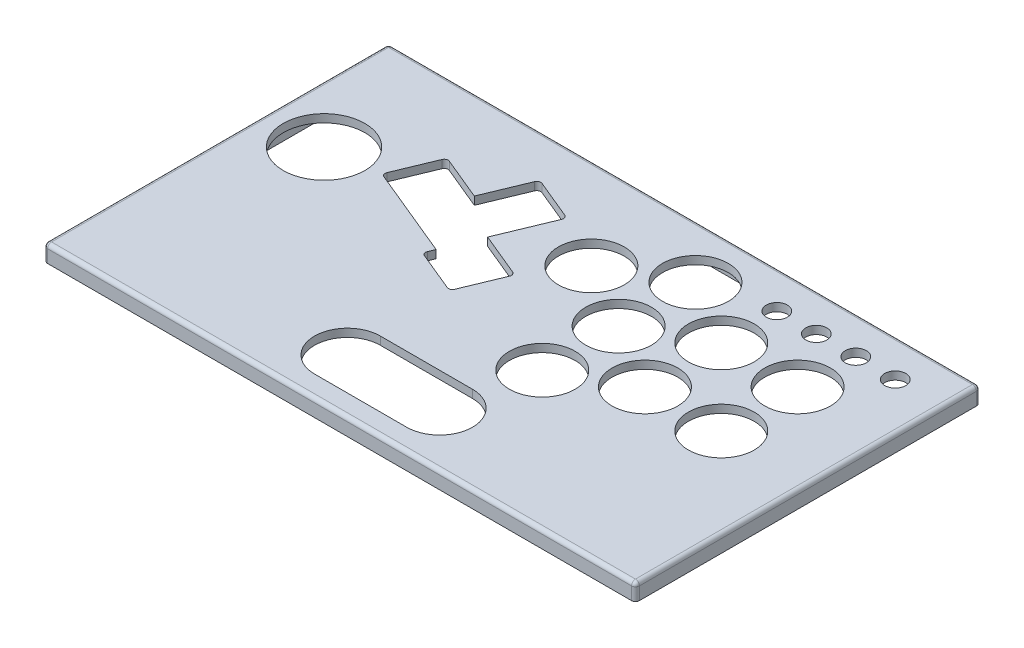
from build123d import *

# Parameters (mm, degrees)
SKETCH2_W                       = 224.807886448
SKETCH2_H                       = 130.999439424
TOP_PLATE_DEPTH                 = 6.35
PRIMARY_BUTTON_CUTOUTS_REACH    = 159.75
BUTTON_CUTOUTS_R                = 12.5
BUTTON_CUTOUTS_R_2              = 15.5
FILLET1_R                       = 1.5
EXTRA_BUTTONS_REACH             = 159.75
SKETCH3_R                       = 4
SKETCH4_W                       = 212.807886448
SKETCH4_H                       = 118.999439424
CUT_EXTRUDE2_DEPTH              = 3.3
FILLET2_R                       = 1.5
SKETCH5_W                       = 35
SKETCH5_H                       = 6
CUT_EXTRUDE3_DEPTH              = 3
TAP_DRILL_FOR_M3X0_5_TAP1_D     = 2.5
TAP_DRILL_FOR_M3X0_5_TAP1_DEPTH = 4
TAP_DRILL_FOR_M3X0_5_TAP1_TIP   = 0.751075774


with BuildPart() as part:
    # Sketch2 → top plate (new body)
    with BuildSketch(Plane(origin=(0, 0, 0), x_dir=(1, 0, 0), z_dir=(0, 1, 0))):
        with Locations((0, 44.999719712)):
            Rectangle(SKETCH2_W, SKETCH2_H)
    extrude(amount=TOP_PLATE_DEPTH)

    # Button Cutouts → primary button cutouts (cut, up to next)
    with BuildSketch(Plane(origin=(0, 0, 0), x_dir=(1, 0, 0), z_dir=(0, 1, 0)), mode=Mode.PRIVATE) as primary_button_cutouts_sk1:
        with Locations((24.5, 32)):
            Circle(BUTTON_CUTOUTS_R)
    primary_button_cutouts_tool1 = extrude(primary_button_cutouts_sk1.sketch, amount=PRIMARY_BUTTON_CUTOUTS_REACH, mode=Mode.PRIVATE) & part.part
    # Button Cutouts → primary button cutouts (cut, up to next)
    with BuildSketch(Plane(origin=(0, 0, 0), x_dir=(1, 0, 0), z_dir=(0, 1, 0)), mode=Mode.PRIVATE) as primary_button_cutouts_sk2:
        with Locations((24.5, 61)):
            Circle(BUTTON_CUTOUTS_R)
    primary_button_cutouts_tool2 = extrude(primary_button_cutouts_sk2.sketch, amount=PRIMARY_BUTTON_CUTOUTS_REACH, mode=Mode.PRIVATE) & part.part
    # Button Cutouts → primary button cutouts (cut, up to next)
    with BuildSketch(Plane(origin=(0, 0, 0), x_dir=(1, 0, 0), z_dir=(0, 1, 0)), mode=Mode.PRIVATE) as primary_button_cutouts_sk3:
        with Locations((49.5, 46)):
            Circle(BUTTON_CUTOUTS_R)
    primary_button_cutouts_tool3 = extrude(primary_button_cutouts_sk3.sketch, amount=PRIMARY_BUTTON_CUTOUTS_REACH, mode=Mode.PRIVATE) & part.part
    # Button Cutouts → primary button cutouts (cut, up to next)
    with BuildSketch(Plane(origin=(0, 0, 0), x_dir=(1, 0, 0), z_dir=(0, 1, 0)), mode=Mode.PRIVATE) as primary_button_cutouts_sk4:
        with Locations((49.5, 75)):
            Circle(BUTTON_CUTOUTS_R)
    primary_button_cutouts_tool4 = extrude(primary_button_cutouts_sk4.sketch, amount=PRIMARY_BUTTON_CUTOUTS_REACH, mode=Mode.PRIVATE) & part.part
    # Button Cutouts → primary button cutouts (cut, up to next)
    with BuildSketch(Plane(origin=(0, 0, 0), x_dir=(1, 0, 0), z_dir=(0, 1, 0)), mode=Mode.PRIVATE) as primary_button_cutouts_sk5:
        with Locations((78.5, 75)):
            Circle(BUTTON_CUTOUTS_R)
    primary_button_cutouts_tool5 = extrude(primary_button_cutouts_sk5.sketch, amount=PRIMARY_BUTTON_CUTOUTS_REACH, mode=Mode.PRIVATE) & part.part
    # Button Cutouts → primary button cutouts (cut, up to next)
    with BuildSketch(Plane(origin=(0, 0, 0), x_dir=(1, 0, 0), z_dir=(0, 1, 0)), mode=Mode.PRIVATE) as primary_button_cutouts_sk6:
        with Locations((78.5, 46)):
            Circle(BUTTON_CUTOUTS_R)
    primary_button_cutouts_tool6 = extrude(primary_button_cutouts_sk6.sketch, amount=PRIMARY_BUTTON_CUTOUTS_REACH, mode=Mode.PRIVATE) & part.part
    # Button Cutouts → primary button cutouts (cut, up to next)
    with BuildSketch(Plane(origin=(0, 0, 0), x_dir=(1, 0, 0), z_dir=(0, 1, 0)), mode=Mode.PRIVATE) as primary_button_cutouts_sk7:
        with Locations((-90.403943224, 64.008304483)):
            Circle(BUTTON_CUTOUTS_R_2)
    primary_button_cutouts_tool7 = extrude(primary_button_cutouts_sk7.sketch, amount=PRIMARY_BUTTON_CUTOUTS_REACH, mode=Mode.PRIVATE) & part.part
    # Button Cutouts → primary button cutouts (cut, up to next)
    with BuildSketch(Plane(origin=(0, 0, 0), x_dir=(1, 0, 0), z_dir=(0, 1, 0)), mode=Mode.PRIVATE) as primary_button_cutouts_sk8:
        with Locations((24.680313923, 89.999439424)):
            Circle(BUTTON_CUTOUTS_R)
    primary_button_cutouts_tool8 = extrude(primary_button_cutouts_sk8.sketch, amount=PRIMARY_BUTTON_CUTOUTS_REACH, mode=Mode.PRIVATE) & part.part
    # Button Cutouts → primary button cutouts (cut, up to next)
    with BuildSketch(Plane(origin=(0, 0, 0), x_dir=(1, 0, 0), z_dir=(0, 1, 0)), mode=Mode.PRIVATE) as primary_button_cutouts_sk9:
        with Locations((-0.524094275, 75.65587615)):
            Circle(BUTTON_CUTOUTS_R)
    primary_button_cutouts_tool9 = extrude(primary_button_cutouts_sk9.sketch, amount=PRIMARY_BUTTON_CUTOUTS_REACH, mode=Mode.PRIVATE) & part.part
    # Button Cutouts → primary button cutouts (cut, up to next)
    with BuildSketch(Plane(origin=(0, 0, 0), x_dir=(1, 0, 0), z_dir=(0, 1, 0)), mode=Mode.PRIVATE) as primary_button_cutouts_sk10:
        with BuildLine():
            Line((17.5, -12.5), (-17.5, -12.5))
            ThreePointArc((-17.5, -12.5), (-30, 0), (-17.5, 12.5))
            Line((-17.5, 12.5), (17.5, 12.5))
            ThreePointArc((17.5, 12.5), (30, 0), (17.5, -12.5))
        make_face()
    primary_button_cutouts_tool10 = extrude(primary_button_cutouts_sk10.sketch, amount=PRIMARY_BUTTON_CUTOUTS_REACH, mode=Mode.PRIVATE) & part.part
    # Button Cutouts → primary button cutouts (cut, up to next)
    with BuildSketch(Plane(origin=(0, 0, 0), x_dir=(1, 0, 0), z_dir=(0, 1, 0)), mode=Mode.PRIVATE) as primary_button_cutouts_sk11:
        Polygon((-70.581424626, 66.134393952), (-63.310439411, 83.688105069), (-45.710534316, 76.397985683), (-38.42041493, 93.997890777), (-20.866703812, 86.726905562), (-29.687556928, 65.431482338), (-12.087651834, 58.141362951), (-19.358637049, 40.587651834), (-36.912348166, 47.858637049), (-35.381614437, 51.554155179), align=None)
    primary_button_cutouts_tool11 = extrude(primary_button_cutouts_sk11.sketch, amount=PRIMARY_BUTTON_CUTOUTS_REACH, mode=Mode.PRIVATE) & part.part
    add(primary_button_cutouts_tool1.solids().sort_by_distance((24.5, 0, -32))[0], mode=Mode.SUBTRACT)
    add(primary_button_cutouts_tool2.solids().sort_by_distance((24.5, 0, -61))[0], mode=Mode.SUBTRACT)
    add(primary_button_cutouts_tool3.solids().sort_by_distance((49.5, 0, -46))[0], mode=Mode.SUBTRACT)
    add(primary_button_cutouts_tool4.solids().sort_by_distance((49.5, 0, -75))[0], mode=Mode.SUBTRACT)
    add(primary_button_cutouts_tool5.solids().sort_by_distance((78.5, 0, -75))[0], mode=Mode.SUBTRACT)
    add(primary_button_cutouts_tool6.solids().sort_by_distance((78.5, 0, -46))[0], mode=Mode.SUBTRACT)
    add(primary_button_cutouts_tool7.solids().sort_by_distance((-90.403943, 0, -64.008304))[0], mode=Mode.SUBTRACT)
    add(primary_button_cutouts_tool8.solids().sort_by_distance((24.680314, 0, -89.999439))[0], mode=Mode.SUBTRACT)
    add(primary_button_cutouts_tool9.solids().sort_by_distance((-0.524094, 0, -75.655876))[0], mode=Mode.SUBTRACT)
    add(primary_button_cutouts_tool10.solids().sort_by_distance((0, 0, 0))[0], mode=Mode.SUBTRACT)
    add(primary_button_cutouts_tool11.solids().sort_by_distance((-39.131182, 0, -67.460691))[0], mode=Mode.SUBTRACT)

    # Fillet1
    fillet1_edges = [part.edges().sort_by_distance(p)[0] for p in [
        (-20.866703812, 3.175, -86.726905562),
        (-12.087651834, 3.175, -58.141362951),
        (-19.358637049, 3.175, -40.587651834),
        (-36.912348166, 3.175, -47.858637049),
        (-70.581424626, 3.175, -66.134393952),
        (-63.310439411, 3.175, -83.688105069),
        (-38.42041493, 3.175, -93.997890777),
    ]]
    fillet(fillet1_edges, radius=FILLET1_R)

    # Sketch3 → extra buttons (cut, up to next)
    with BuildSketch(Plane(origin=(0, 6.35, 0), x_dir=(1, 0, 0), z_dir=(0, 1, 0)), mode=Mode.PRIVATE) as extra_buttons_sk1:
        with Locations((49.596056725, 96.00000015)):
            Circle(SKETCH3_R)
    extra_buttons_tool1 = extrude(extra_buttons_sk1.sketch, amount=-EXTRA_BUTTONS_REACH, mode=Mode.PRIVATE) & part.part
    # Sketch3 → extra buttons (cut, up to next)
    with BuildSketch(Plane(origin=(0, 6.35, 0), x_dir=(1, 0, 0), z_dir=(0, 1, 0)), mode=Mode.PRIVATE) as extra_buttons_sk2:
        with Locations((64.596056725, 96.00000015)):
            Circle(SKETCH3_R)
    extra_buttons_tool2 = extrude(extra_buttons_sk2.sketch, amount=-EXTRA_BUTTONS_REACH, mode=Mode.PRIVATE) & part.part
    # Sketch3 → extra buttons (cut, up to next)
    with BuildSketch(Plane(origin=(0, 6.35, 0), x_dir=(1, 0, 0), z_dir=(0, 1, 0)), mode=Mode.PRIVATE) as extra_buttons_sk3:
        with Locations((79.596056725, 96.00000015)):
            Circle(SKETCH3_R)
    extra_buttons_tool3 = extrude(extra_buttons_sk3.sketch, amount=-EXTRA_BUTTONS_REACH, mode=Mode.PRIVATE) & part.part
    # Sketch3 → extra buttons (cut, up to next)
    with BuildSketch(Plane(origin=(0, 6.35, 0), x_dir=(1, 0, 0), z_dir=(0, 1, 0)), mode=Mode.PRIVATE) as extra_buttons_sk4:
        with Locations((94.596056725, 96.00000015)):
            Circle(SKETCH3_R)
    extra_buttons_tool4 = extrude(extra_buttons_sk4.sketch, amount=-EXTRA_BUTTONS_REACH, mode=Mode.PRIVATE) & part.part
    add(extra_buttons_tool1.solids().sort_by_distance((49.596057, 6.35, -96))[0], mode=Mode.SUBTRACT)
    add(extra_buttons_tool2.solids().sort_by_distance((64.596057, 6.35, -96))[0], mode=Mode.SUBTRACT)
    add(extra_buttons_tool3.solids().sort_by_distance((79.596057, 6.35, -96))[0], mode=Mode.SUBTRACT)
    add(extra_buttons_tool4.solids().sort_by_distance((94.596057, 6.35, -96))[0], mode=Mode.SUBTRACT)

    # Sketch4 → Cut-Extrude2 (cut)
    with BuildSketch(Plane.XZ):
        with Locations((0, -44.999719712)):
            Rectangle(SKETCH4_W, SKETCH4_H)
    extrude(amount=-CUT_EXTRUDE2_DEPTH, mode=Mode.SUBTRACT)

    # Fillet2
    fillet2_edges = [part.edges().sort_by_distance(p)[0] for p in [
        (112.403943224, 3.175, -110.499439424),
        (-112.403943224, 3.175, -110.499439424),
        (-112.403943224, 3.175, 20.5),
        (112.403943224, 3.175, 20.5),
        (112.403943224, 6.35, -44.999719712),
        (0, 6.35, -110.499439424),
        (0, 6.35, 20.5),
        (-112.403943224, 6.35, -44.999719712),
    ]]
    fillet(fillet2_edges, radius=FILLET2_R)

    # Sketch5 → Cut-Extrude3 (cut)
    with BuildSketch(Plane.XZ):
        with Locations((-65.408693946, -107.499439424)):
            Rectangle(SKETCH5_W, SKETCH5_H)
    extrude(amount=-CUT_EXTRUDE3_DEPTH, mode=Mode.SUBTRACT)

    # Tap Drill for M3x0.5 Tap1
    with Locations(Plane(origin=(-108.403943224, 0, 16.5), x_dir=(0, 0, -1), z_dir=(0, -1, 0))):
        with Locations((0, 0), (122.999439424, 0), (122.999439424, 216.807886448), (0, 216.807886448)):
            Hole(TAP_DRILL_FOR_M3X0_5_TAP1_D / 2, depth=TAP_DRILL_FOR_M3X0_5_TAP1_DEPTH)
            with Locations((0, 0, -(TAP_DRILL_FOR_M3X0_5_TAP1_DEPTH + TAP_DRILL_FOR_M3X0_5_TAP1_TIP / 2))):  # 118° drill point
                Cone(0, TAP_DRILL_FOR_M3X0_5_TAP1_D / 2, TAP_DRILL_FOR_M3X0_5_TAP1_TIP, mode=Mode.SUBTRACT)


solid = part.part
